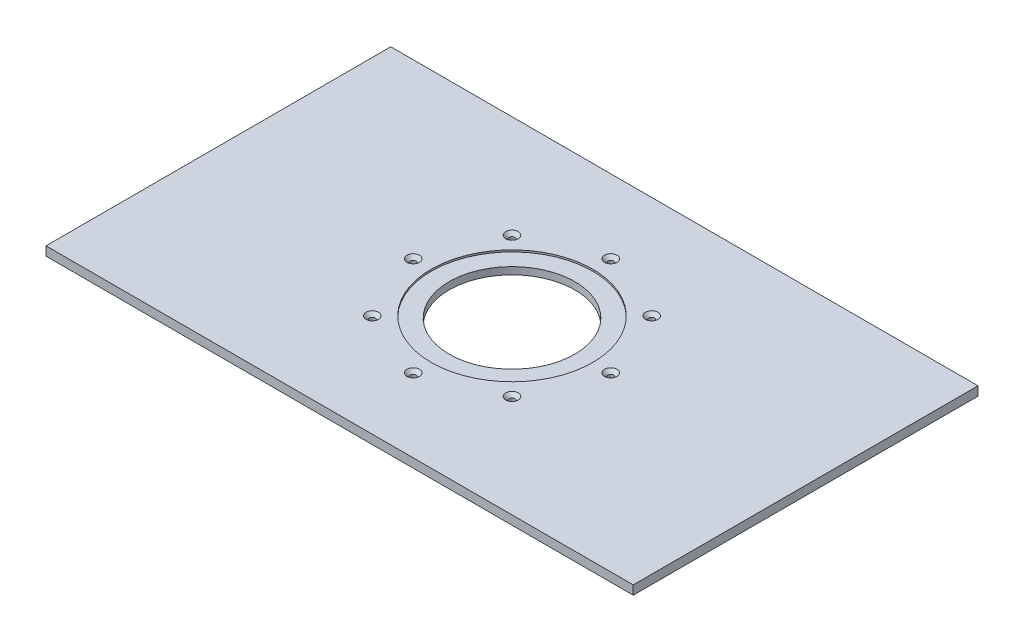
from build123d import *

# Parameters (mm, degrees)
SKETCH1_W                                            = 327
SKETCH1_H                                            = 192
BOSS_EXTRUDE1_DEPTH                                  = 5
SKETCH2_R                                            = 35
CUT_EXTRUDE1_DEPTH                                   = 190.666154071
SKETCH3_R                                            = 45
CUT_EXTRUDE2_DEPTH                                   = 1
CSK_FOR_M3_HEX_SOCKET_COUNTERSUNK_HEAD_S_D           = 3.2
CSK_FOR_M3_HEX_SOCKET_COUNTERSUNK_HEAD_S_CSINK_D     = 6.94
CSK_FOR_M3_HEX_SOCKET_COUNTERSUNK_HEAD_S_CSINK_ANGLE = 90


with BuildPart() as part:
    # Sketch1 → Boss-Extrude1 (new body)
    with BuildSketch(Plane(origin=(0, 0, 0), x_dir=(1, 0, 0), z_dir=(0, 1, 0))):
        Rectangle(SKETCH1_W, SKETCH1_H)
    extrude(amount=BOSS_EXTRUDE1_DEPTH)

    # Sketch2 → Cut-Extrude1 (cut, through all)
    with BuildSketch(Plane(origin=(0, 5, 0), x_dir=(1, 0, 0), z_dir=(0, 1, 0))):
        Circle(SKETCH2_R)
    extrude(amount=-CUT_EXTRUDE1_DEPTH, mode=Mode.SUBTRACT)

    # Sketch3 → Cut-Extrude2 (cut)
    with BuildSketch(Plane(origin=(0, 5, 0), x_dir=(1, 0, 0), z_dir=(0, 1, 0))):
        Circle(SKETCH3_R)
    extrude(amount=-CUT_EXTRUDE2_DEPTH, mode=Mode.SUBTRACT)

    # CSK for M3 Hex Socket Countersunk Head Screw1 (through all)
    with Locations(Plane(origin=(0, 5, 0), x_dir=(1, 0, 0), z_dir=(0, 1, 0))):
        with Locations((-38.890872965, -38.890872965), (-55, 0), (-38.890872965, 38.890872965), (0, 55), (38.890872965, 38.890872965), (55, 0), (38.890872965, -38.890872965), (0, -55)):
            CounterSinkHole(CSK_FOR_M3_HEX_SOCKET_COUNTERSUNK_HEAD_S_D / 2, CSK_FOR_M3_HEX_SOCKET_COUNTERSUNK_HEAD_S_CSINK_D / 2, counter_sink_angle=CSK_FOR_M3_HEX_SOCKET_COUNTERSUNK_HEAD_S_CSINK_ANGLE)


solid = part.part
